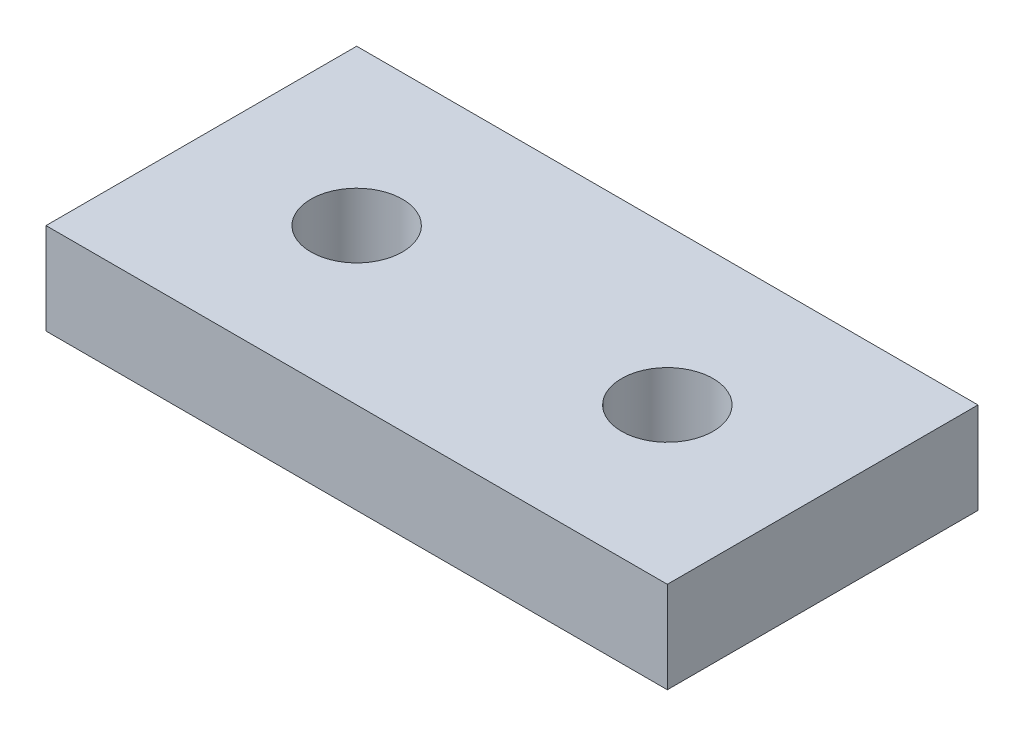
from build123d import *

# Parameters (mm, degrees)
SKETCH1_W           = 34
SKETCH1_H           = 17
SKETCH1_R           = 2.505
BOSS_EXTRUDE1_DEPTH = 5


with BuildPart() as part:
    # sketch1 → Boss-Extrude1 (new body)
    with BuildSketch(Plane(origin=(0, 0, 0), x_dir=(1, 0, 0), z_dir=(0, 1, 0))):
        with Locations((17, -8.5)):
            Rectangle(SKETCH1_W, SKETCH1_H)
        with Locations((8.5, -8.5)):
            Circle(SKETCH1_R, mode=Mode.SUBTRACT)
        with Locations((25.5, -8.5)):
            Circle(SKETCH1_R, mode=Mode.SUBTRACT)
    extrude(amount=BOSS_EXTRUDE1_DEPTH)


solid = part.part
